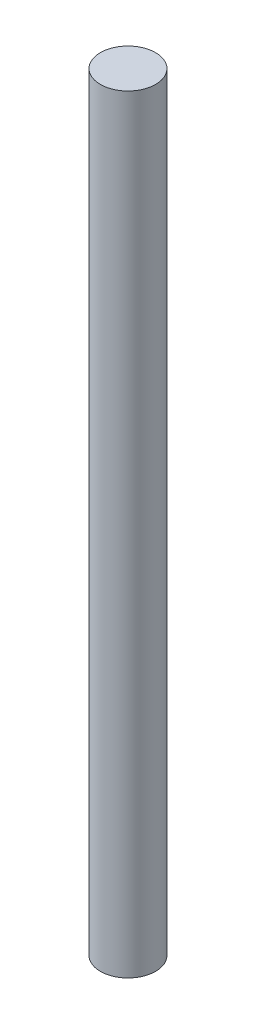
from build123d import *

# Parameters (mm, degrees)
SKETCH1_R           = 4
BOSS_EXTRUDE1_DEPTH = 55.7


with BuildPart() as part:
    # Sketch1 → Boss-Extrude1 (new, symmetric)
    with BuildSketch(Plane(origin=(0, 0, 0), x_dir=(1, 0, 0), z_dir=(0, 1, 0))):
        Circle(SKETCH1_R)
    extrude(amount=BOSS_EXTRUDE1_DEPTH, both=True)


solid = part.part
